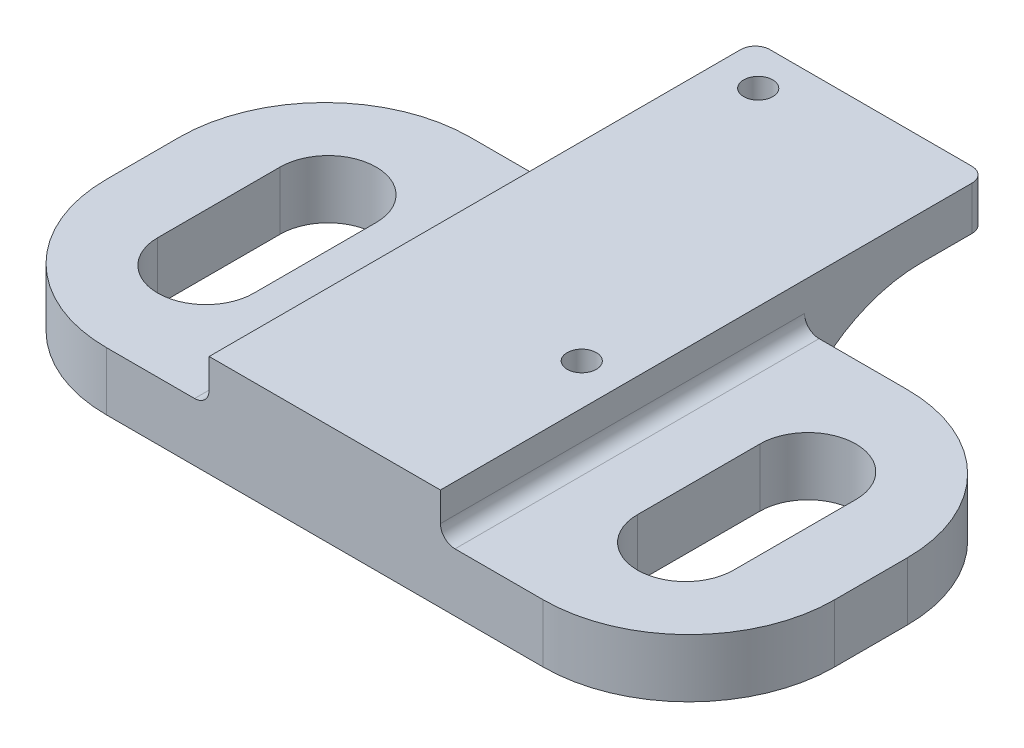
from build123d import *

# Parameters (mm, degrees)
SKETCH1_W                = 50
SKETCH1_H                = 25
BOSS_EXTRUDE1_DEPTH      = 4
SKETCH2_W                = 15.88
SKETCH2_H                = 37.5
BOSS_EXTRUDE2_DEPTH      = 3
M6_CLEARANCE_SLOT1_DEPTH = 4
M3_CLEARANCE_HOLE1_D     = 2
FILLET3_R                = 10
FILLET4_R                = 10
FILLET5_R                = 1


# Read off the part's stored shape, not the designer's step: M6 Clearance Slot1
with BuildPart() as part:
    # Sketch1 → Boss-Extrude1 (new body)
    with BuildSketch(Plane(origin=(0, 0, 0), x_dir=(1, 0, 0), z_dir=(0, 1, 0))):
        with Locations((25, 12.5)):
            Rectangle(SKETCH1_W, SKETCH1_H)
    extrude(amount=BOSS_EXTRUDE1_DEPTH)

    # Sketch2 → Boss-Extrude2 (add)
    with BuildSketch(Plane(origin=(0, 4, 0), x_dir=(1, 0, 0), z_dir=(0, 1, 0))):
        with Locations((25, 18.75)):
            Rectangle(SKETCH2_W, SKETCH2_H)
    extrude(amount=BOSS_EXTRUDE2_DEPTH)

    # M6 Clearance Slot1 outline → M6 Clearance Slot1 (cut)
    with BuildSketch(Plane(origin=(0, 0, 0), x_dir=(1, 0, 0), z_dir=(0, 1, 0))):
        with BuildLine():
            Line((44.77, 8.3), (44.77, 16.7))
            ThreePointArc((44.77, 16.7), (41.47, 20), (38.17, 16.7))
            Line((38.17, 16.7), (38.17, 8.3))
            ThreePointArc((38.17, 8.3), (41.47, 5), (44.77, 8.3))
        make_face()
        with BuildLine():
            Line((11.83, 8.3), (11.83, 16.7))
            ThreePointArc((11.83, 16.7), (8.53, 20), (5.23, 16.7))
            Line((5.23, 16.7), (5.23, 8.3))
            ThreePointArc((5.23, 8.3), (8.53, 5), (11.83, 8.3))
        make_face()
    extrude(amount=M6_CLEARANCE_SLOT1_DEPTH, mode=Mode.SUBTRACT)

    # M3 Clearance Hole1 (through all)
    with Locations(Plane(origin=(0, 7, 0), x_dir=(1, 0, 0), z_dir=(0, 1, 0))):
        with Locations((19.96, 34.8), (30.12, 12.525)):
            Hole(M3_CLEARANCE_HOLE1_D / 2)

    # Fillet3
    fillet3_edges = [part.edges().sort_by_distance(p)[0] for p in [
        (0, 2, -25),
        (50, 2, -25),
        (50, 2, 0),
        (0, 2, 0),
    ]]
    fillet(fillet3_edges, radius=FILLET3_R)

    # Fillet4
    # the kernel refuses this fillet: 10 mm, written as the material it adds along each edge
    with BuildSketch(Plane(origin=(32.94, 4, -25), x_dir=(0, -1, 0), z_dir=(-1, 0, 0))) as fillet4_piece_1:
        with BuildLine():
            CenterArc((10, -8), FILLET4_R, 126.869897646, 53.130102354)
            Line((0, -8), (-0.2, -8))
            Line((-0.2, -8), (-0.2, 0))
            Line((-0.2, 0), (0, 0.2))
            ThreePointArc((0, 0.2), (2, 0.2), (3.88, 0.16))
            Line((3.88, 0.16), (4, 0))
        make_face()
    extrude(amount=15.88)

    # Fillet5
    fillet5_edges = [part.edges().sort_by_distance(p)[0] for p in [
        (32.94, 4, -12.5),
        (17.06, 4, -12.5),
        (32.94, 5.5, -37.5),
        (17.06, 5.5, -37.5),
    ]]
    fillet(fillet5_edges, radius=FILLET5_R)


solid = part.part
